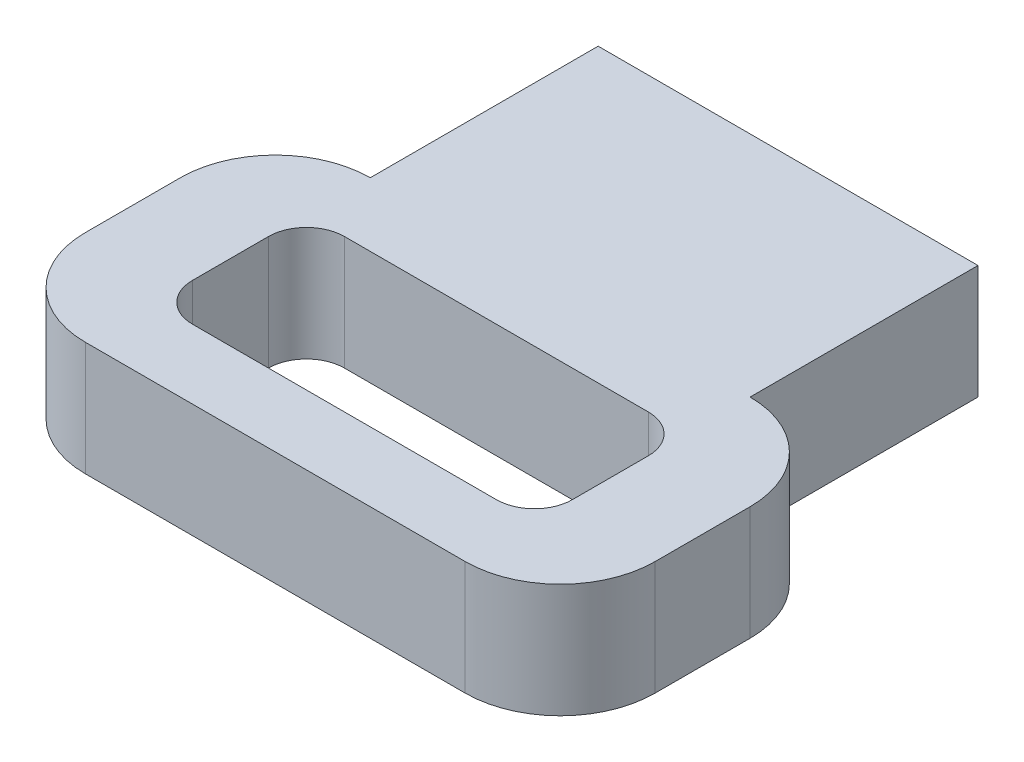
from build123d import *

# Parameters (mm, degrees)
SKETCH1_W           = 50.8
SKETCH1_H           = 15.24
BOSS_EXTRUDE2_DEPTH = 30.48
SKETCH2_W           = 76.2
SKETCH2_H           = 15.24
BOSS_EXTRUDE3_DEPTH = 38.1
SKETCH3_W           = 50.8
SKETCH3_H           = 20.32
CUT_EXTRUDE1_DEPTH  = 80.919234231
FILLET1_R           = 5.08
FILLET4_R           = 12.7


with BuildPart() as part:
    # Sketch1 → Boss-Extrude2 (new body)
    with BuildSketch(Plane.XY):
        Rectangle(SKETCH1_W, SKETCH1_H)
    extrude(amount=BOSS_EXTRUDE2_DEPTH)

    # Sketch2 → Boss-Extrude3 (add)
    with BuildSketch(Plane.XY.offset(30.48)):
        Rectangle(SKETCH2_W, SKETCH2_H)
    extrude(amount=BOSS_EXTRUDE3_DEPTH)

    # Sketch3 → Cut-Extrude1 (cut, through all)
    with BuildSketch(Plane.XZ.offset(7.62)):
        with Locations((0, 49.167262881)):
            Rectangle(SKETCH3_W, SKETCH3_H)
    extrude(amount=-CUT_EXTRUDE1_DEPTH, mode=Mode.SUBTRACT)

    # Fillet1
    fillet1_edges = [part.edges().sort_by_distance(p)[0] for p in [
        (-25.4, 0, 39.007262881),
        (-25.4, 0, 59.327262881),
        (25.4, 0, 59.327262881),
        (25.4, 0, 39.007262881),
    ]]
    fillet(fillet1_edges, radius=FILLET1_R)

    # Fillet4
    fillet4_edges = [part.edges().sort_by_distance(p)[0] for p in [
        (38.1, 0, 30.48),
        (38.1, 0, 68.58),
        (-38.1, 0, 30.48),
        (-38.1, 0, 68.58),
    ]]
    fillet(fillet4_edges, radius=FILLET4_R - 0.0001)  # a hair under: the kernel refuses the full size


solid = part.part
